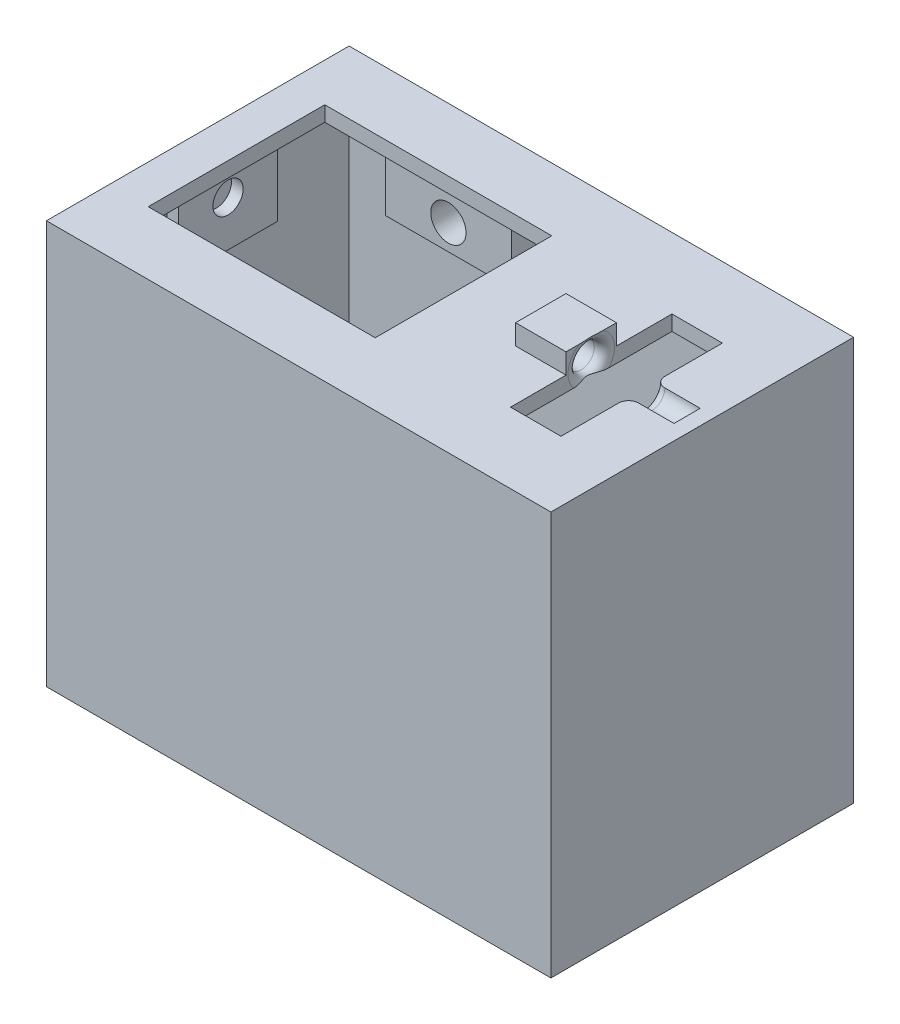
from build123d import *

# Parameters (mm, degrees)
SKETCH1_W                           = 127
SKETCH1_H                           = 76.2
MAIN_BODY_DEPTH                     = 101.6
HOLLOW_IT_T                         = -3.81
HOLE_FOR_SCROLLWHEEL_REACH          = 127.724
SKETCH2_W                           = 12.7
SKETCH2_H                           = 40.64
NIBBLE_BASE_HOLE_DEPTH              = 12.7
NIBBLE_HOLE_DEPTH                   = 24.13
NIBBLE_HOLE_DEPTH_BACK              = 11.43
SKETCH5_R                           = 3.302
EASY_TO_INSERT_SCROLL_WHEEL_R       = 2.54
SKETCH6_W                           = 57.15
SKETCH6_H                           = 44.45
HOLE_FOR_JOYSTICK_DEPTH             = 11.43
SKETCH10_W                          = 44.45
SKETCH10_H                          = 6.985
SKETCH10_W_2                        = 31.75
BOX_NIBBLE_BASE_DEPTH               = 15.24
SKETCH11_W                          = 4.572
SKETCH11_H                          = 24.856466434
SKETCH11_W_2                        = 2.948658359
ARCH_NIBBLE_BASE_DEPTH              = 17.78
ARCH_NIBBLE_HOLES_REACH             = 134.21
SKETCH12_R                          = 3.81
ARCH_NIBBLE_HOLES_DIRECTION_2_REACH = 134.21
BOX_NIBBLE_HOLES_REACH              = 141.158
SKETCH13_R                          = 4.445
BOX_NIBBLE_HOLES_DIRECTION_2_REACH  = 141.158


with BuildPart() as part:
    # Sketch1 → main body (new body)
    with BuildSketch(Plane(origin=(0, 0, 0), x_dir=(1, 0, 0), z_dir=(0, 1, 0))):
        Rectangle(SKETCH1_W, SKETCH1_H)
    extrude(amount=MAIN_BODY_DEPTH)

    # hollow it
    hollow_it_openings = [part.faces().sort_by_distance(p)[0] for p in [
        (0, 0, 0),
    ]]
    offset(amount=HOLLOW_IT_T, openings=hollow_it_openings, kind=Kind.INTERSECTION)

    # Sketch2 → hole for scrollwheel (cut, up to next)
    with BuildSketch(Plane(origin=(0, 101.6, 0), x_dir=(1, 0, 0), z_dir=(0, 1, 0)), mode=Mode.PRIVATE) as hole_for_scrollwheel_sk1:
        with Locations((41.91, 0)):
            Rectangle(SKETCH2_W, SKETCH2_H)
    hole_for_scrollwheel_tool1 = extrude(hole_for_scrollwheel_sk1.sketch, amount=-HOLE_FOR_SCROLLWHEEL_REACH, mode=Mode.PRIVATE) & part.part
    add(hole_for_scrollwheel_tool1.solids().sort_by_distance((41.91, 101.6, 0))[0], mode=Mode.SUBTRACT)

    # Sketch3 → nibble base hole (add)
    with BuildSketch(Plane(origin=(35.56, 0, 0), x_dir=(0, 0, -1), z_dir=(1, 0, 0))):
        Polygon((0, 101.6), (6.35, 101.6), (6.35, 106.68), (-6.35, 106.68), (-6.35, 101.6), align=None)
    extrude(amount=-NIBBLE_BASE_HOLE_DEPTH)

    # Sketch5 → nibble hole (cut, two sides: drawn at the far end of the back side and taken through both)
    with BuildSketch(Plane(origin=(35.56, 0, 0), x_dir=(0, 0, -1), z_dir=(1, 0, 0)).offset(-NIBBLE_HOLE_DEPTH_BACK)):
        with Locations(Location((0, 101.6, 0), (0, 0, 180))):
            Circle(SKETCH5_R)
    extrude(amount=NIBBLE_HOLE_DEPTH + NIBBLE_HOLE_DEPTH_BACK, mode=Mode.SUBTRACT)

    # easy to insert scroll wheel
    # the kernel refuses this fillet: 2.54 mm, written as the material it takes off along each edge
    with BuildSketch(Plane(origin=(48.26, 101.6, 0), x_dir=(0, 0.9999950652018582, -0.0031415874858792044), z_dir=(0, 0.0031415874858792044, 0.9999950652018582))) as easy_to_insert_scroll_wheel_piece_1:
        with BuildLine():
            CenterArc((3.302 + EASY_TO_INSERT_SCROLL_WHEEL_R, -EASY_TO_INSERT_SCROLL_WHEEL_R), EASY_TO_INSERT_SCROLL_WHEEL_R, 90, 90)
            Line((3.302, -EASY_TO_INSERT_SCROLL_WHEEL_R), (3.302, 0))
            Line((3.302, 0), (3.302 + EASY_TO_INSERT_SCROLL_WHEEL_R, 0))
        make_face()
    revolve(axis=Axis((48.26, 101.6, 0), (-1, 0, 0)), revolution_arc=359.64, mode=Mode.SUBTRACT)
    with BuildSketch(Plane(origin=(35.56, 101.6, 0), x_dir=(0, 0, 1), z_dir=(0, 1, 0))) as easy_to_insert_scroll_wheel_piece_2:
        with BuildLine():
            CenterArc((3.302 + EASY_TO_INSERT_SCROLL_WHEEL_R, -EASY_TO_INSERT_SCROLL_WHEEL_R), EASY_TO_INSERT_SCROLL_WHEEL_R, 90, 90)
            Line((3.302, -EASY_TO_INSERT_SCROLL_WHEEL_R), (3.302, 0))
            Line((3.302, 0), (3.302 + EASY_TO_INSERT_SCROLL_WHEEL_R, 0))
        make_face()
    revolve(axis=Axis((35.56, 101.6, 0), (1, 0, 0)), mode=Mode.SUBTRACT)

    # Sketch6 → hole for joystick (cut)
    with BuildSketch(Plane(origin=(0, 101.6, 0), x_dir=(1, 0, 0), z_dir=(0, 1, 0))):
        with Locations((-25.173658359, 0)):
            Rectangle(SKETCH6_W, SKETCH6_H)
    extrude(amount=-HOLE_FOR_JOYSTICK_DEPTH, mode=Mode.SUBTRACT)

    # Sketch10 → box nibble base (add)
    with BuildSketch(Plane.XZ.offset(-97.79)):
        with Locations((-25.173658359, 28.2575)):
            Rectangle(SKETCH10_W, SKETCH10_H)
        with Locations((-25.173658359, -28.2575)):
            Rectangle(SKETCH10_W_2, SKETCH10_H)
    extrude(amount=BOX_NIBBLE_BASE_DEPTH)

    # Sketch11 → arch nibble base (add)
    with BuildSketch(Plane.XZ.offset(-97.79)):
        with Locations((6.957341641, 0)):
            Rectangle(SKETCH11_W, SKETCH11_H)
        with Locations((-57.354329179, 0)):
            Rectangle(SKETCH11_W_2, SKETCH11_H)
    extrude(amount=ARCH_NIBBLE_BASE_DEPTH)

    # arch nibble holes: up to this face of the body (flat: up to its plane)
    arch_nibble_holes_end = Plane(part.part.faces().sort_by_distance((9.243341641, 88.9, 0))[0])
    # Sketch12 → arch nibble holes (cut, up to the picked face)
    with BuildSketch(Plane.ZY.offset(-4.671341641), mode=Mode.PRIVATE) as arch_nibble_holes_sk1:
        with Locations((0, 91.44)):
            Circle(SKETCH12_R)
    arch_nibble_holes_tool1 = split(extrude(arch_nibble_holes_sk1.sketch, amount=-ARCH_NIBBLE_HOLES_REACH, mode=Mode.PRIVATE), bisect_by=arch_nibble_holes_end, keep=Keep.BOTH, mode=Mode.PRIVATE)
    add(arch_nibble_holes_tool1.solids().sort_by(Axis((4.671342, 91.44, 0), (1, 0, 0)))[0], mode=Mode.SUBTRACT)

    # arch nibble holes direction 2: up to this face of the body (flat: up to its plane)
    arch_nibble_holes_direction_2_end = Plane(part.part.faces().sort_by_distance((-59.69, 48.895, 0))[0])
    # Sketch12 → arch nibble holes direction 2 (cut, up to the picked face)
    with BuildSketch(Plane.ZY.offset(-4.671341641), mode=Mode.PRIVATE) as arch_nibble_holes_direction_2_sk1:
        with Locations((0, 91.44)):
            Circle(SKETCH12_R)
    arch_nibble_holes_direction_2_tool1 = split(extrude(arch_nibble_holes_direction_2_sk1.sketch, amount=ARCH_NIBBLE_HOLES_DIRECTION_2_REACH, mode=Mode.PRIVATE), bisect_by=arch_nibble_holes_direction_2_end, keep=Keep.BOTH, mode=Mode.PRIVATE)
    add(arch_nibble_holes_direction_2_tool1.solids().sort_by(Axis((4.671342, 91.44, 0), (-1, 0, 0)))[0], mode=Mode.SUBTRACT)

    # box nibble holes: up to this face of the body (flat: up to its plane)
    box_nibble_holes_end = Plane(part.part.faces().sort_by_distance((0, 48.895, -34.29))[0])
    # Sketch13 → box nibble holes (cut, up to the picked face)
    with BuildSketch(Plane.XY.offset(-24.765), mode=Mode.PRIVATE) as box_nibble_holes_sk1:
        with Locations((-25.173658359, 88.9)):
            Circle(SKETCH13_R)
    box_nibble_holes_tool1 = split(extrude(box_nibble_holes_sk1.sketch, amount=-BOX_NIBBLE_HOLES_REACH, mode=Mode.PRIVATE), bisect_by=box_nibble_holes_end, keep=Keep.BOTH, mode=Mode.PRIVATE)
    add(box_nibble_holes_tool1.solids().sort_by(Axis((-25.173658, 88.9, -24.765), (0, 0, -1)))[0], mode=Mode.SUBTRACT)

    # box nibble holes direction 2: up to this face of the body (flat: up to its plane)
    box_nibble_holes_direction_2_end = Plane(part.part.faces().sort_by_distance((0, 48.895, 34.29))[0])
    # Sketch13 → box nibble holes direction 2 (cut, up to the picked face)
    with BuildSketch(Plane.XY.offset(-24.765), mode=Mode.PRIVATE) as box_nibble_holes_direction_2_sk1:
        with Locations((-25.173658359, 88.9)):
            Circle(SKETCH13_R)
    box_nibble_holes_direction_2_tool1 = split(extrude(box_nibble_holes_direction_2_sk1.sketch, amount=BOX_NIBBLE_HOLES_DIRECTION_2_REACH, mode=Mode.PRIVATE), bisect_by=box_nibble_holes_direction_2_end, keep=Keep.BOTH, mode=Mode.PRIVATE)
    add(box_nibble_holes_direction_2_tool1.solids().sort_by(Axis((-25.173658, 88.9, -24.765), (0, 0, 1)))[0], mode=Mode.SUBTRACT)


solid = part.part
